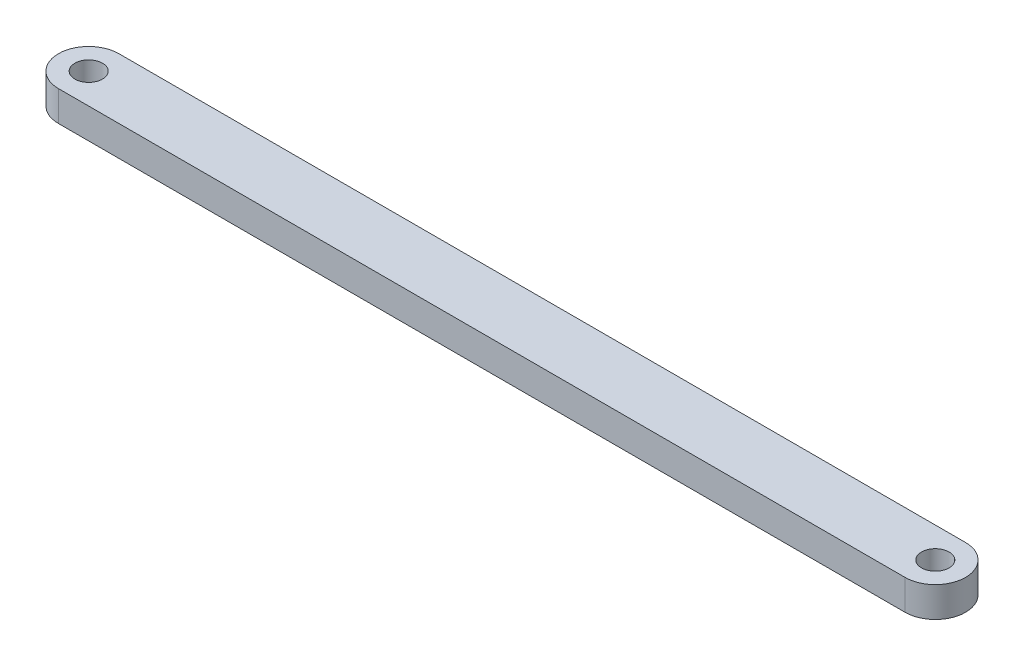
from build123d import *

# Parameters (mm, degrees)
SKETCH1_R           = 1.45
BOSS_EXTRUDE1_DEPTH = 3.175


with BuildPart() as part:
    # Sketch1 → Boss-Extrude1 (new body)
    with BuildSketch(Plane(origin=(0, 0, 0), x_dir=(1, 0, 0), z_dir=(0, 1, 0))):
        with BuildLine():
            Line((-44.45, 3.175), (44.45, 3.175))
            ThreePointArc((44.45, 3.175), (47.625, 0), (44.45, -3.175))
            Line((44.45, -3.175), (-44.45, -3.175))
            ThreePointArc((-44.45, -3.175), (-47.625, 0), (-44.45, 3.175))
        make_face()
        with Locations((-44.45, 0)):
            Circle(SKETCH1_R, mode=Mode.SUBTRACT)
        with Locations((44.45, 0)):
            Circle(SKETCH1_R, mode=Mode.SUBTRACT)
    extrude(amount=BOSS_EXTRUDE1_DEPTH)


solid = part.part
